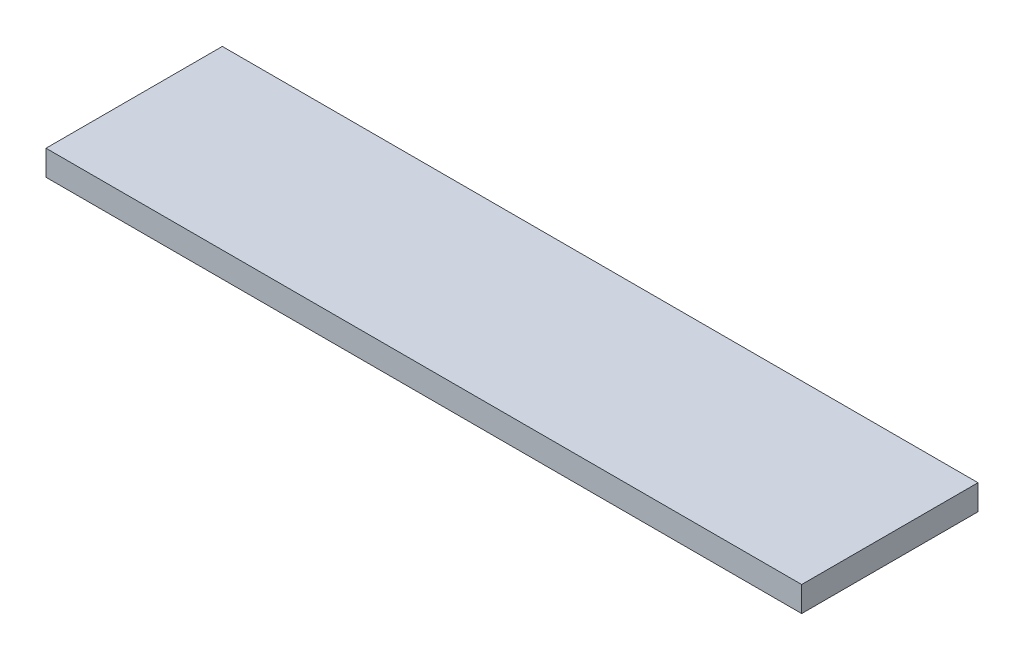
from build123d import *

# Parameters (mm, degrees)
SKETCH_1_W      = 300
SKETCH_1_H      = 70
EXTRUDE_1_DEPTH = 10


with BuildPart() as part:
    # 草图1 → 凸台-拉伸1 (new body)
    with BuildSketch(Plane(origin=(0, 0, 0), x_dir=(1, 0, 0), z_dir=(0, 1, 0))):
        Rectangle(SKETCH_1_W, SKETCH_1_H)
    extrude(amount=EXTRUDE_1_DEPTH)


solid = part.part
